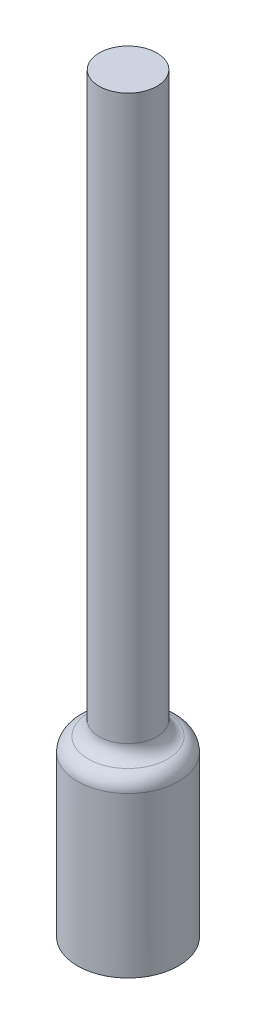
from build123d import *

# Parameters (mm, degrees)
SKETCH_1_R      = 3.5
SKETCH_1_R_2    = 1.99
EXTRUDE_1_DEPTH = 12
SKETCH_2_R      = 2
EXTRUDE_2_DEPTH = 40
FILLET_1_R      = 1
FILLET_2_R      = 1


with BuildPart() as part:
    # Эскиз1 → Вытянуть1 (new body)
    with BuildSketch(Plane(origin=(0, 0, 0), x_dir=(1, 0, 0), z_dir=(0, 1, 0))):
        Circle(SKETCH_1_R)
        Circle(SKETCH_1_R_2, mode=Mode.SUBTRACT)
    extrude(amount=EXTRUDE_1_DEPTH)

    # Эскиз2 → Вытянуть2 (add)
    with BuildSketch(Plane(origin=(0, 12, 0), x_dir=(1, 0, 0), z_dir=(0, 1, 0))):
        Circle(SKETCH_2_R)
    extrude(amount=EXTRUDE_2_DEPTH)

    # Скругление1
    fillet_1_edges = [part.edges().sort_by_distance(p)[0] for p in [
        (-2, 12, 0),
    ]]
    fillet(fillet_1_edges, radius=FILLET_1_R)

    # Скругление2
    fillet_2_edges = [part.edges().sort_by_distance(p)[0] for p in [
        (-3.5, 12, 0),
    ]]
    fillet(fillet_2_edges, radius=FILLET_2_R)


solid = part.part
